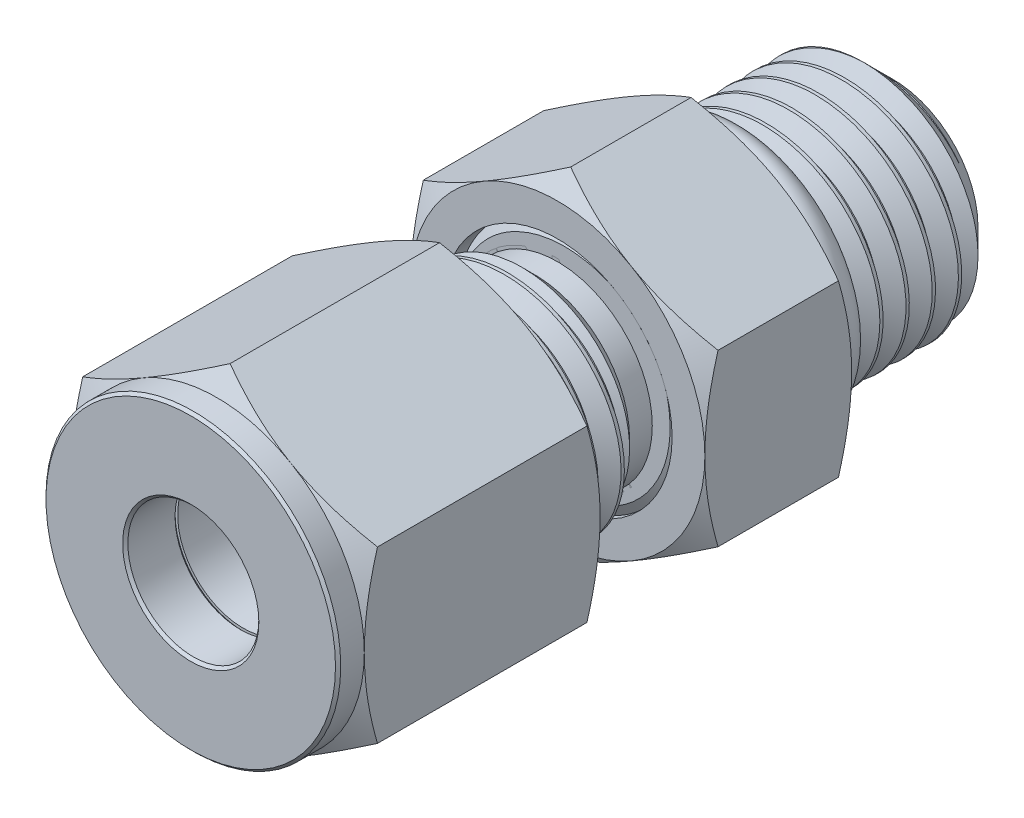
from build123d import *

# Parameters (mm, degrees)
BOSS_EXTRUDE1_DEPTH = 12.7
CHAMFER1_SIZE       = 0.127
SKETCH4_W           = 17.526
SKETCH4_H           = 5.55625
BOSS_EXTRUDE2_DEPTH = 7.112
SKETCH11_W          = 9.144
SKETCH11_H          = 5.55625
SKETCH15_R          = 0.9144
SKETCH17_OUTSIDE_W  = 121.988
SKETCH17_OUTSIDE_H  = 124.198
SKETCH17_OUTSIDE_R  = 7.14375
CUT_EXTRUDE1_DEPTH  = 28.178834537
CUT_EXTRUDE1_DRAFT  = -60
SKETCH18_OUTSIDE_W  = 100.106
SKETCH18_OUTSIDE_H  = 102.316
SKETCH18_OUTSIDE_R  = 7.14375
CUT_EXTRUDE2_DEPTH  = 21.861586297
CUT_EXTRUDE2_DRAFT  = -60
CHAMFER2_SIZE       = 1.42875
CUT_SWEEP1_PITCH    = 1.27
CUT_SWEEP2_PITCH    = 1.27
SKETCH19_W          = 7.112
SKETCH19_H          = 0.824889197


with BuildPart() as part:
    # Sketch2 → Boss-Extrude1 (new body)
    with BuildSketch(Plane.XY):
        Polygon((0, 8.248891971), (-7.14375, 4.124445986), (-7.14375, -4.124445986), (0, -8.248891971), (7.14375, -4.124445986), (7.14375, 4.124445986), align=None)
    extrude(amount=-BOSS_EXTRUDE1_DEPTH)

    # Sketch3 → Cut-Revolve1 (revolve, cut)
    with BuildSketch(Plane(origin=(0, 0, 0), x_dir=(0, 0, -1), z_dir=(1, 0, 0)), mode=Mode.PRIVATE) as cut_revolve1_sk:
        Polygon((0, 8.248891971), (0, 7.14375), (1.27, 7.14375), (1.908054014, 8.248891971), (12.061945986, 8.248891971), (12.7, 7.14375), (12.7, 8.248891971), (12.7, 9.354033942), (0, 9.354033942), align=None)
        Polygon((0, 3.175), (0, 0), (12.7, 0), (12.7, 5.55625), (5.08, 5.55625), (5.08, 4.92125), (2.54, 4.92125), (2.54, 4.28625), (2.54, 3.175), align=None)
    revolve(cut_revolve1_sk.sketch.rotate(Axis((0, 0, 0), (0, 0, -1)), 90), axis=Axis((0, 0, 0), (0, 0, -1)), mode=Mode.SUBTRACT)

    # Chamfer1
    chamfer1_edges = [part.edges().sort_by_distance(p)[0] for p in [
        (-7.14375, 0, 0),
        (-3.175, 0, -2.54),
        (-3.175, 0, 0),
    ]]
    chamfer(chamfer1_edges, length=CHAMFER1_SIZE)


with BuildPart() as body_2:
    # Sketch4 → Revolve1 (revolve)
    with BuildSketch(Plane(origin=(0, 0, 0), x_dir=(0, 0, -1), z_dir=(1, 0, 0)), mode=Mode.PRIVATE) as revolve1_sk:
        with Locations((16.129, 2.778125)):
            Rectangle(SKETCH4_W, SKETCH4_H)
    revolve(revolve1_sk.sketch.rotate(Axis((0, 0, -24.892), (0, 0, 1)), 90), axis=Axis((0, 0, -24.892), (0, 0, 1)))


with BuildPart() as body_3:
    # Sketch7 → Boss-Extrude2 (new body)
    with BuildSketch(Plane(origin=(0, 0, -24.892), x_dir=(-1, 0, 0), z_dir=(0, 0, -1))):
        Polygon((0, 8.248891971), (-7.14375, 4.124445986), (-7.14375, -4.124445986), (0, -8.248891971), (7.14375, -4.124445986), (7.14375, 4.124445986), align=None)
    extrude(amount=-BOSS_EXTRUDE2_DEPTH)


with BuildPart() as body_4:
    # Sketch9 → Revolve2 (revolve)
    with BuildSketch(Plane(origin=(0, 0, 0), x_dir=(0, 0, -1), z_dir=(1, 0, 0)), mode=Mode.PRIVATE) as revolve2_sk:
        Polygon((4.445, 4.699), (4.445, 3.8608), (5.1308, 3.175), (9.3218, 3.175), (9.3218, 3.6068), align=None)
    revolve(revolve2_sk.sketch.rotate(Axis((0, 0, 0), (0, 0, -1)), 90), axis=Axis((0, 0, 0), (0, 0, -1)))


with BuildPart() as body_5:
    # Sketch10 → Revolve3 (revolve)
    with BuildSketch(Plane(origin=(0, 0, 0), x_dir=(0, 0, -1), z_dir=(1, 0, 0)), mode=Mode.PRIVATE) as revolve3_sk:
        Polygon((2.54, 4.6609), (3.556, 4.6609), (3.556, 3.8608), (4.445, 3.8608), (5.1308, 3.175), (2.54, 3.175), align=None)
    revolve(revolve3_sk.sketch.rotate(Axis((0, 0, 0), (0, 0, -1)), 90), axis=Axis((0, 0, 0), (0, 0, -1)))


with BuildPart() as body_6:
    # Sketch11 → Revolve4 (revolve)
    with BuildSketch(Plane(origin=(0, 0, 0), x_dir=(0, 0, -1), z_dir=(1, 0, 0)), mode=Mode.PRIVATE) as revolve4_sk:
        with Locations((29.464, 2.778125)):
            Rectangle(SKETCH11_W, SKETCH11_H)
    revolve(revolve4_sk.sketch.rotate(Axis((0, 0, -24.892), (0, 0, -1)), 90), axis=Axis((0, 0, -24.892), (0, 0, -1)))


with BuildPart() as body_7:
    # Sketch15 → Revolve5 (revolve)
    with BuildSketch(Plane(origin=(0, 0, 0), x_dir=(0, 0, -1), z_dir=(1, 0, 0)), mode=Mode.PRIVATE) as revolve5_sk:
        with Locations((25.8064, 5.3721)):
            Circle(SKETCH15_R)
    revolve(revolve5_sk.sketch.rotate(Axis((0, 0, 0), (0, 0, -1)), 270), axis=Axis((0, 0, 0), (0, 0, -1)))


with BuildPart() as cut_extrude1_tool:
    # Sketch17 outside → Cut-Extrude1 (with draft: the straight prism first)
    with BuildSketch(Plane(origin=(0, 0, -24.892), x_dir=(-1, 0, 0), z_dir=(0, 0, -1))):
        Rectangle(SKETCH17_OUTSIDE_W, SKETCH17_OUTSIDE_H)
        with Locations(Location((0, 0, 0), (0, 0, 180))):
            Circle(SKETCH17_OUTSIDE_R, mode=Mode.SUBTRACT)
    extrude(amount=-CUT_EXTRUDE1_DEPTH)
    # Cut-Extrude1: the draft: its side faces are tilted about the plane it starts from
    cut_extrude1_sides = [cut_extrude1_tool.faces().sort_by_distance(p)[0] for p in [
        (0, -62.099, -10.802582731),
        (-60.994, 0, -10.802582731),
        (0, 62.099, -10.802582731),
        (60.994, 0, -10.802582731),
        (-7.14375, 0, -10.802582731),
    ]]
    draft(cut_extrude1_sides, Plane(origin=(0, 0, -24.892), x_dir=(-1, 0, 0), z_dir=(0, 0, -1)), CUT_EXTRUDE1_DRAFT)


with BuildPart() as body_3_1:
    add(body_3.part)

    # Cut-Extrude1: cut by cut_extrude1_tool
    add(cut_extrude1_tool.part, mode=Mode.SUBTRACT)


with BuildPart() as cut_extrude2_tool:
    # Sketch18 outside → Cut-Extrude2 (with draft: the straight prism first)
    with BuildSketch(Plane.XY.offset(-17.78)):
        Rectangle(SKETCH18_OUTSIDE_W, SKETCH18_OUTSIDE_H)
        Circle(SKETCH18_OUTSIDE_R, mode=Mode.SUBTRACT)
    extrude(amount=-CUT_EXTRUDE2_DEPTH)
    # Cut-Extrude2: the draft: its side faces are tilted about the plane it starts from
    cut_extrude2_sides = [cut_extrude2_tool.faces().sort_by_distance(p)[0] for p in [
        (0, -51.158, -28.710793148),
        (50.053, 0, -28.710793148),
        (0, 51.158, -28.710793148),
        (-50.053, 0, -28.710793148),
        (-7.14375, 0, -28.710793148),
    ]]
    draft(cut_extrude2_sides, Plane.XY.offset(-17.78), CUT_EXTRUDE2_DRAFT)


with BuildPart() as body_3_2:
    add(body_3_1.part)

    # Cut-Extrude2: cut by cut_extrude2_tool
    add(cut_extrude2_tool.part, mode=Mode.SUBTRACT)


with BuildPart() as cut_revolve5_tool:
    # Sketch16 → Cut-Revolve5 (revolve)
    with BuildSketch(Plane(origin=(0, 0, 0), x_dir=(0, 0, -1), z_dir=(1, 0, 0))):
        Polygon((34.036, 0), (7.366, 0), (7.366, 4.044817708), (11.249837209, 3.175), (15.24, 3.175), (15.24, 2.3749), (34.036, 2.3749), (35.6235, 2.3749), (35.6235, 0), align=None)
    revolve(axis=Axis((0, 0, -34.036), (0, 0, 1)))


with BuildPart() as body_3_3:
    add(body_3_2.part)

    # Cut-Revolve5: cut by cut_revolve5_tool
    add(cut_revolve5_tool.part, mode=Mode.SUBTRACT)

    # Sketch19 → Cut-Revolve7 (revolve, cut)
    with BuildSketch(Plane(origin=(0, 0, 0), x_dir=(0, 0, -1), z_dir=(1, 0, 0)), mode=Mode.PRIVATE) as cut_revolve7_sk:
        with Locations((21.336, 5.143805401)):
            Rectangle(SKETCH19_W, SKETCH19_H)
    revolve(cut_revolve7_sk.sketch.rotate(Axis((0, 0, 0), (0, 0, -1)), 90), axis=Axis((0, 0, 0), (0, 0, -1)), mode=Mode.SUBTRACT)


with BuildPart() as body_2_1:
    add(body_2.part)

    # Cut-Revolve5: cut by cut_revolve5_tool
    add(cut_revolve5_tool.part, mode=Mode.SUBTRACT)

    # Cut-Sweep1: the profile of Sketch6 screwed along a right-hand helix of 14.8 turns, 8 arcs to a turn; built about Z, then put on its axis
    cut_sweep1_z = Axis((0, 0, 0), (0, 0, 1))
    cut_sweep1_corners = [(4.731360803, 0, -0.635), (5.624990766, 0, -1.1509375), (5.624990766, 0, 0.0396875), (4.731360803, 0, -0.47625)]
    with BuildLine(mode=Mode.PRIVATE) as cut_sweep1_profile:
        Line(cut_sweep1_corners[0], cut_sweep1_corners[1])
        Line(cut_sweep1_corners[1], cut_sweep1_corners[2])
        Line(cut_sweep1_corners[2], cut_sweep1_corners[3])
        Line(cut_sweep1_corners[3], cut_sweep1_corners[0])
    cut_sweep1_cap = Face(cut_sweep1_profile.wire())
    cut_sweep1_turn_angles = [0, 22.5, 45, 67.5, 90, 112.5, 135, 157.5, 180, 202.5, 225, 247.5, 270, 292.5, 315, 337.5, 360]
    cut_sweep1_turn_weights = [1, 0.9238795325112867, 1, 0.9238795325112867, 1, 0.9238795325112867, 1, 0.9238795325112867, 1, 0.9238795325112867, 1, 0.9238795325112867, 1, 0.9238795325112867, 1, 0.9238795325112867, 1]
    cut_sweep1_turn_rails = [Edge.make_bspline([Vector(p[0], p[1], 0).rotate(cut_sweep1_z, cut_sweep1_turn_angles[k]) / cut_sweep1_turn_weights[k] + Vector(0, 0, p[2] + CUT_SWEEP1_PITCH * cut_sweep1_turn_angles[k] / 360) for k in range(17)], [0, 0, 0, 1, 1, 2, 2, 3, 3, 4, 4, 5, 5, 6, 6, 7, 7, 8, 8, 8], 2, cut_sweep1_turn_weights) for p in cut_sweep1_corners]
    cut_sweep1_turn_sides = [Face.make_surface_from_curves(cut_sweep1_turn_rails[p[0]], cut_sweep1_turn_rails[p[1]]) for p in [(0, 1), (1, 2), (2, 3), (3, 0)]]
    cut_sweep1_last_angles = [5040, 5062.5, 5085, 5107.5, 5130, 5152.5, 5175, 5197.5, 5220, 5242.5, 5265, 5287.5, 5310, 5319, 5328]
    cut_sweep1_last_weights = [1, 0.9238795325112867, 1, 0.9238795325112867, 1, 0.9238795325112867, 1, 0.9238795325112867, 1, 0.9238795325112867, 1, 0.9238795325112867, 1, 0.9876883405951241, 1]
    cut_sweep1_last_rails = [Edge.make_bspline([Vector(p[0], p[1], 0).rotate(cut_sweep1_z, cut_sweep1_last_angles[k]) / cut_sweep1_last_weights[k] + Vector(0, 0, p[2] + CUT_SWEEP1_PITCH * cut_sweep1_last_angles[k] / 360) for k in range(15)], [0, 0, 0, 1, 1, 2, 2, 3, 3, 4, 4, 5, 5, 6, 6, 7, 7, 7], 2, cut_sweep1_last_weights) for p in cut_sweep1_corners]
    cut_sweep1_last_sides = [Face.make_surface_from_curves(cut_sweep1_last_rails[p[0]], cut_sweep1_last_rails[p[1]]) for p in [(0, 1), (1, 2), (2, 3), (3, 0)]]
    cut_sweep1 = Plane(origin=(0, 0, -7.366), x_dir=(0, 1, 0), z_dir=(0, 0, -1)) * Solid(Shell([*[p.moved(Location((0, 0, CUT_SWEEP1_PITCH * i))) for i in range(14) for p in cut_sweep1_turn_sides], *cut_sweep1_last_sides, cut_sweep1_cap, cut_sweep1_cap.rotate(cut_sweep1_z, 5328).moved(Location((0, 0, CUT_SWEEP1_PITCH * 5328 / 360)))]))
    add(cut_sweep1, mode=Mode.SUBTRACT)

    # Sketch8 → Cut-Revolve2 (revolve, cut)
    with BuildSketch(Plane(origin=(0, 0, 0), x_dir=(0, 0, -1), z_dir=(1, 0, 0)), mode=Mode.PRIVATE) as cut_revolve2_sk:
        Polygon((7.366, 5.693731533), (7.366, 4.59387927), (8.465852263, 5.693731533), align=None)
        Polygon((17.78, 5.693731533), (15.580295474, 5.693731533), (16.680147737, 4.59387927), (17.78, 4.59387927), align=None)
    revolve(cut_revolve2_sk.sketch.rotate(Axis((0, 0, 0), (0, 0, -1)), 90), axis=Axis((0, 0, 0), (0, 0, -1)), mode=Mode.SUBTRACT)


with BuildPart() as body_6_1:
    add(body_6.part)

    # Cut-Revolve5: cut by cut_revolve5_tool
    add(cut_revolve5_tool.part, mode=Mode.SUBTRACT)

    # Chamfer2
    chamfer2_edges = [body_6_1.edges().sort_by_distance(p)[0] for p in [
        (-5.55625, 0, -34.036),
    ]]
    chamfer(chamfer2_edges, length=CHAMFER2_SIZE)

    # Cut-Sweep2: the profile of Sketch13 screwed along a right-hand helix of 8.2 turns, 8 arcs to a turn; built about Z, then put on its axis
    cut_sweep2_z = Axis((0, 0, 0), (0, 0, 1))
    cut_sweep2_corners = [(5.693731533, 0, 0.079375), (5.624990766, 0, -1.1509375), (4.731360803, 0, -0.635), (4.731360803, 0, -0.47625)]
    with BuildLine(mode=Mode.PRIVATE) as cut_sweep2_profile:
        Line(cut_sweep2_corners[0], cut_sweep2_corners[1])
        Line(cut_sweep2_corners[1], cut_sweep2_corners[2])
        Line(cut_sweep2_corners[2], cut_sweep2_corners[3])
        Line(cut_sweep2_corners[3], cut_sweep2_corners[0])
    cut_sweep2_cap = Face(cut_sweep2_profile.wire())
    cut_sweep2_turn_angles = [0, 22.5, 45, 67.5, 90, 112.5, 135, 157.5, 180, 202.5, 225, 247.5, 270, 292.5, 315, 337.5, 360]
    cut_sweep2_turn_weights = [1, 0.9238795325112867, 1, 0.9238795325112867, 1, 0.9238795325112867, 1, 0.9238795325112867, 1, 0.9238795325112867, 1, 0.9238795325112867, 1, 0.9238795325112867, 1, 0.9238795325112867, 1]
    cut_sweep2_turn_rails = [Edge.make_bspline([Vector(p[0], p[1], 0).rotate(cut_sweep2_z, cut_sweep2_turn_angles[k]) / cut_sweep2_turn_weights[k] + Vector(0, 0, p[2] + CUT_SWEEP2_PITCH * cut_sweep2_turn_angles[k] / 360) for k in range(17)], [0, 0, 0, 1, 1, 2, 2, 3, 3, 4, 4, 5, 5, 6, 6, 7, 7, 8, 8, 8], 2, cut_sweep2_turn_weights) for p in cut_sweep2_corners]
    cut_sweep2_turn_sides = [Face.make_surface_from_curves(cut_sweep2_turn_rails[p[0]], cut_sweep2_turn_rails[p[1]]) for p in [(0, 1), (1, 2), (2, 3), (3, 0)]]
    cut_sweep2_last_angles = [2880, 2902.5, 2925, 2938.5, 2952]
    cut_sweep2_last_weights = [1, 0.9238795325112867, 1, 0.9723699203976682, 1]
    cut_sweep2_last_rails = [Edge.make_bspline([Vector(p[0], p[1], 0).rotate(cut_sweep2_z, cut_sweep2_last_angles[k]) / cut_sweep2_last_weights[k] + Vector(0, 0, p[2] + CUT_SWEEP2_PITCH * cut_sweep2_last_angles[k] / 360) for k in range(5)], [0, 0, 0, 1, 1, 2, 2, 2], 2, cut_sweep2_last_weights) for p in cut_sweep2_corners]
    cut_sweep2_last_sides = [Face.make_surface_from_curves(cut_sweep2_last_rails[p[0]], cut_sweep2_last_rails[p[1]]) for p in [(0, 1), (1, 2), (2, 3), (3, 0)]]
    cut_sweep2 = Plane(origin=(0, 0, -35.306), x_dir=(0, 1, 0), z_dir=(0, 0, 1)) * Solid(Shell([*[p.moved(Location((0, 0, CUT_SWEEP2_PITCH * i))) for i in range(8) for p in cut_sweep2_turn_sides], *cut_sweep2_last_sides, cut_sweep2_cap, cut_sweep2_cap.rotate(cut_sweep2_z, 2952).moved(Location((0, 0, CUT_SWEEP2_PITCH * 2952 / 360)))]))
    add(cut_sweep2, mode=Mode.SUBTRACT)

    # Sketch14 → Cut-Revolve4 (revolve, cut)
    with BuildSketch(Plane(origin=(0, 0, 0), x_dir=(0, 0, -1), z_dir=(1, 0, 0)), mode=Mode.PRIVATE) as cut_revolve4_sk:
        Polygon((27.091704526, 5.693731533), (24.892, 5.693731533), (24.892, 4.59387927), (25.991852263, 4.59387927), align=None)
    revolve(cut_revolve4_sk.sketch.rotate(Axis((0, 0, 0), (0, 0, -1)), 90), axis=Axis((0, 0, 0), (0, 0, -1)), mode=Mode.SUBTRACT)


with BuildPart() as part_1:
    add(part.part)

    # Combine3: union body 5, body 4
    add(body_5.part)
    add(body_4.part)


with BuildPart() as cut_revolve7_piece_1:
    # of the separate pieces the step leaves, piece 1, a body of its own (cut_revolve7_pieces)
    add(body_3_3.part.solids().sort_by_distance((0, 8.248891971, -24.253945986))[0])


with BuildPart() as cut_revolve7_piece_2:
    # of the separate pieces the step leaves, piece 2, a body of its own (cut_revolve7_pieces)
    add(body_3_3.part.solids().sort_by_distance((4.731360803, 0, -24.892))[0])


solid = Compound([body_7.part, body_2_1.part, body_6_1.part, part_1.part, cut_revolve7_piece_1.part, cut_revolve7_piece_2.part])
